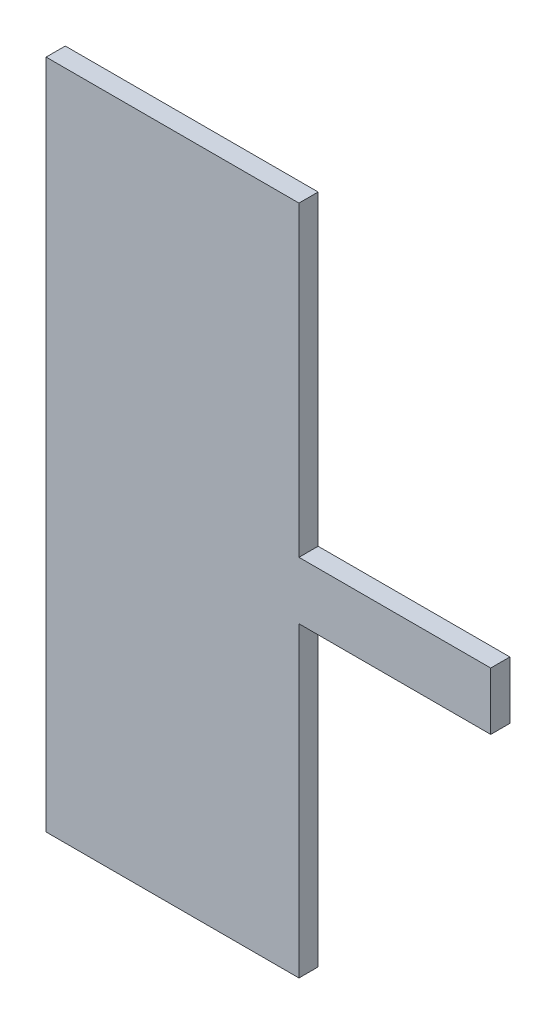
from build123d import *

# Parameters (mm, degrees)
BOSS_EXTRUDE1_DEPTH = 1


with BuildPart() as part:
    # Sketch1 → Boss-Extrude1 (new body)
    with BuildSketch(Plane.XY):
        Polygon((29.736292646, -10), (16.54942814, -10), (16.54942814, 25), (29.736292646, 25), (29.736292646, 9), (39.736292646, 9), (39.736292646, 6), (29.736292646, 6), align=None)
    extrude(amount=BOSS_EXTRUDE1_DEPTH)


solid = part.part
